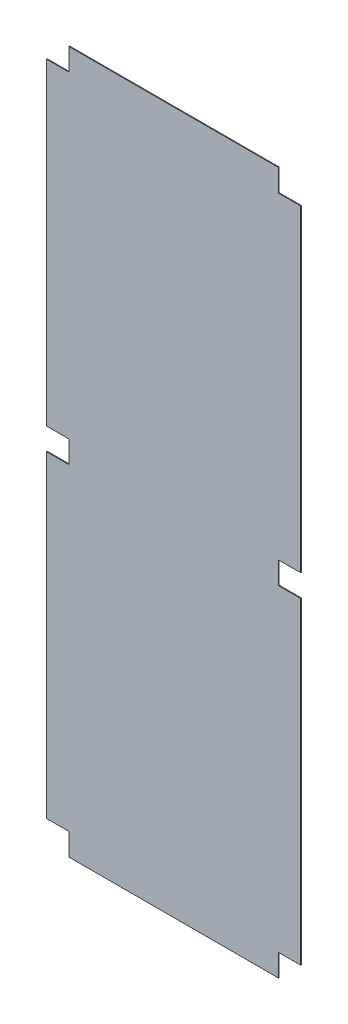
from build123d import *

# Parameters (mm, degrees)
SKETCH1_W          = 240
SKETCH1_H          = 663.4
BASE_FLANGE1_DEPTH = 0.7
SKETCH2_W          = 21
SKETCH2_H          = 21
CUT_EXTRUDE1_DEPTH = 10
SKETCH3_W          = 21
SKETCH3_H          = 21
CUT_EXTRUDE2_DEPTH = 10


# Sheet-metal steps are written as plain solids
with BuildPart() as part:
    # Sketch1 → Base-Flange1 (new body)
    with BuildSketch(Plane.XY):
        with Locations((120, 331.7)):
            Rectangle(SKETCH1_W, SKETCH1_H)
    extrude(amount=-BASE_FLANGE1_DEPTH)

    # Sketch2 → Cut-Extrude1 (cut)
    with BuildSketch(Plane.XY):
        with Locations((229.5, 652.9)):
            Rectangle(SKETCH2_W, SKETCH2_H)
        with Locations((10.5, 652.9)):
            Rectangle(SKETCH2_W, SKETCH2_H)
        with Locations((10.5, 10.5)):
            Rectangle(SKETCH2_W, SKETCH2_H)
        with Locations((229.5, 10.5)):
            Rectangle(SKETCH2_W, SKETCH2_H)
    extrude(amount=-CUT_EXTRUDE1_DEPTH, mode=Mode.SUBTRACT)

    # Sketch3 → Cut-Extrude2 (cut)
    with BuildSketch(Plane(origin=(0, 0, -0.7), x_dir=(-1, 0, 0), z_dir=(0, 0, -1))):
        with Locations((-10.5, 331.7)):
            Rectangle(SKETCH3_W, SKETCH3_H)
        with Locations((-229.5, 331.7)):
            Rectangle(SKETCH3_W, SKETCH3_H)
    extrude(amount=-CUT_EXTRUDE2_DEPTH, mode=Mode.SUBTRACT)


solid = part.part
